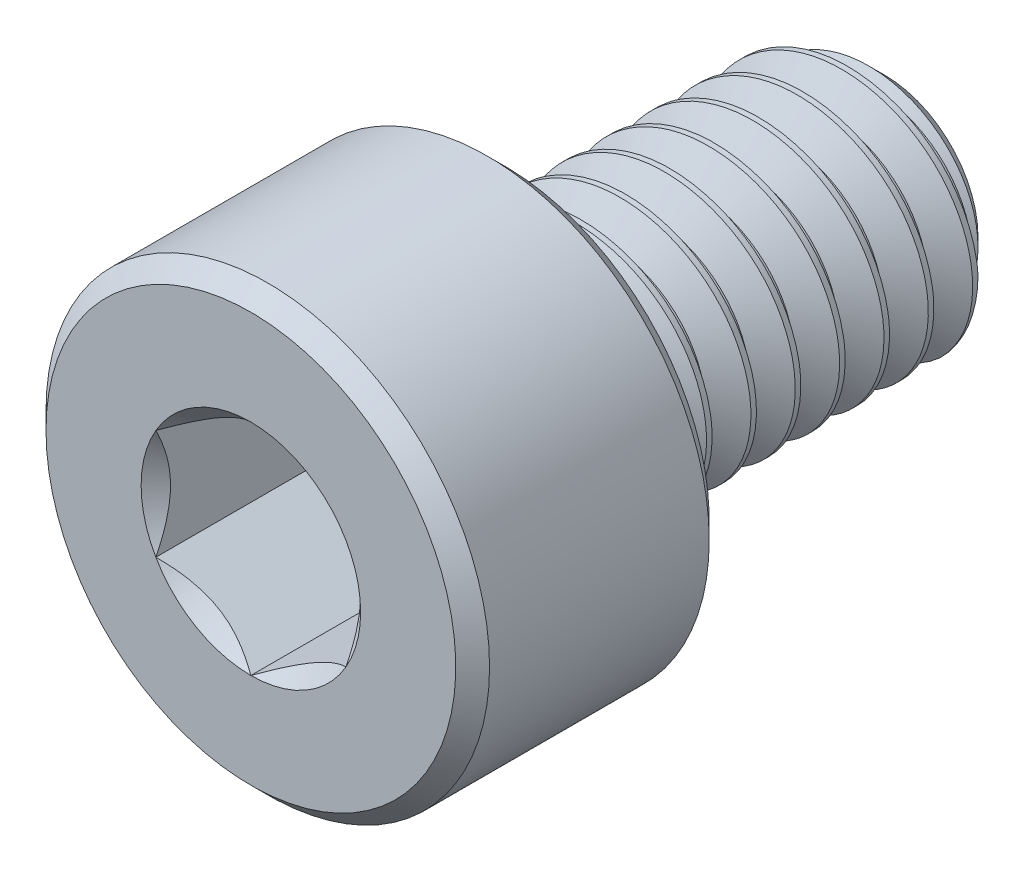
from build123d import *

# Parameters (mm, degrees)
CUT_EXTRUDE1_DEPTH = 3
CUT_SWEEP1_PITCH   = 0.7


# Read off the part's stored shape, not the designer's step: Split1
with BuildPart() as part:
    # Sketch2 → Revolve1 (revolve)
    with BuildSketch(Plane(origin=(0, 0, 0), x_dir=(0, 0, -1), z_dir=(1, 0, 0)), mode=Mode.PRIVATE) as revolve1_sk:
        Polygon((-5, 0), (-5, 3.233333333), (-4.733333333, 3.5), (-1.266666667, 3.5), (-1, 3.233333333), (-1, 2), (4.475, 2), (5, 1.475), (5, 0), align=None)
    revolve(revolve1_sk.sketch.rotate(Axis((0, 0, -5), (0, 0, 1)), 90), axis=Axis((0, 0, -5), (0, 0, 1)))

    # Sketch3 → Cut-Extrude1 (cut)
    with BuildSketch(Plane.XY.offset(5)):
        Polygon((0, 1.732050808), (-1.5, 0.866025404), (-1.5, -0.866025404), (0, -1.732050808), (1.5, -0.866025404), (1.5, 0.866025404), align=None)
    extrude(amount=-CUT_EXTRUDE1_DEPTH, mode=Mode.SUBTRACT)

    # Cut-Extrude2 cone 1 section (through the dimple's axis) → Cut-Extrude2 (revolve, cut)
    with BuildSketch(Plane(origin=(0, 0, 5), x_dir=(0, -1, 0), z_dir=(1, 0, 0))):
        Polygon((0, 0), (1.732050808, 0), (0, 1.732050808), align=None)
    revolve(axis=Axis((0, 0, 5), (0, 0, -1)), mode=Mode.SUBTRACT)


with BuildPart() as body_2:
    # Split1: the piece on the far side of the plane
    add(part.part)
    split(bisect_by=Plane.XY.offset(1), keep=Keep.BOTTOM)

    # Cut-Sweep1: the profile of Sketch6 screwed along a right-hand helix of 9.571429 turns, 6 arcs to a turn; built about Z, then put on its axis
    cut_sweep1_z = Axis((0, 0, 0), (0, 0, 1))
    cut_sweep1_corners = [(2.037888611, 0, 0.021875), (2.037888611, 0, -0.634375), (1.545336663, 0, -0.35), (1.545336663, 0, -0.2625)]
    with BuildLine(mode=Mode.PRIVATE) as cut_sweep1_profile:
        Line(cut_sweep1_corners[0], cut_sweep1_corners[1])
        Line(cut_sweep1_corners[1], cut_sweep1_corners[2])
        Line(cut_sweep1_corners[2], cut_sweep1_corners[3])
        Line(cut_sweep1_corners[3], cut_sweep1_corners[0])
    cut_sweep1_cap = Face(cut_sweep1_profile.wire())
    cut_sweep1_turn_angles = [0, 30, 60, 90, 120, 150, 180, 210, 240, 270, 300, 330, 360]
    cut_sweep1_turn_weights = [1, 0.8660254037844387, 1, 0.8660254037844387, 1, 0.8660254037844387, 1, 0.8660254037844387, 1, 0.8660254037844387, 1, 0.8660254037844387, 1]
    cut_sweep1_turn_rails = [Edge.make_bspline([Vector(p[0], p[1], 0).rotate(cut_sweep1_z, cut_sweep1_turn_angles[k]) / cut_sweep1_turn_weights[k] + Vector(0, 0, p[2] + CUT_SWEEP1_PITCH * cut_sweep1_turn_angles[k] / 360) for k in range(13)], [0, 0, 0, 1, 1, 2, 2, 3, 3, 4, 4, 5, 5, 6, 6, 6], 2, cut_sweep1_turn_weights) for p in cut_sweep1_corners]
    cut_sweep1_turn_sides = [Face.make_surface_from_curves(cut_sweep1_turn_rails[p[0]], cut_sweep1_turn_rails[p[1]]) for p in [(0, 1), (1, 2), (2, 3), (3, 0)]]
    cut_sweep1_turn = Solid(Shell([*cut_sweep1_turn_sides, cut_sweep1_cap, cut_sweep1_cap.rotate(cut_sweep1_z, 360).moved(Location((0, 0, CUT_SWEEP1_PITCH * 360 / 360)))]))
    cut_sweep1_last_angles = [3240, 3270, 3300, 3330, 3360, 3390, 3420, 3432.857142857, 3445.714285714]
    cut_sweep1_last_weights = [1, 0.8660254037844387, 1, 0.8660254037844387, 1, 0.8660254037844387, 1, 0.9749279121818499, 1]
    cut_sweep1_last_rails = [Edge.make_bspline([Vector(p[0], p[1], 0).rotate(cut_sweep1_z, cut_sweep1_last_angles[k]) / cut_sweep1_last_weights[k] + Vector(0, 0, p[2] + CUT_SWEEP1_PITCH * cut_sweep1_last_angles[k] / 360) for k in range(9)], [0, 0, 0, 1, 1, 2, 2, 3, 3, 4, 4, 4], 2, cut_sweep1_last_weights) for p in cut_sweep1_corners]
    cut_sweep1_last_sides = [Face.make_surface_from_curves(cut_sweep1_last_rails[p[0]], cut_sweep1_last_rails[p[1]]) for p in [(0, 1), (1, 2), (2, 3), (3, 0)]]
    cut_sweep1_last = Solid(Shell([*cut_sweep1_last_sides, cut_sweep1_cap.rotate(cut_sweep1_z, 3240).moved(Location((0, 0, CUT_SWEEP1_PITCH * 3240 / 360))), cut_sweep1_cap.rotate(cut_sweep1_z, 3445.714285714).moved(Location((0, 0, CUT_SWEEP1_PITCH * 3445.714285714 / 360)))]))
    cut_sweep1_each = [*[cut_sweep1_turn.moved(Location((0, 0, CUT_SWEEP1_PITCH * i))) for i in range(9)], cut_sweep1_last]
    add(Plane(origin=(0, 0, -5), x_dir=(0, 1, 0), z_dir=(0, 0, 1)) * Compound([cut_sweep1_each[i] for i in range(0, 10, 2)]), mode=Mode.SUBTRACT)
    add(Plane(origin=(0, 0, -5), x_dir=(0, 1, 0), z_dir=(0, 0, 1)) * Compound([cut_sweep1_each[i] for i in range(1, 10, 2)]), mode=Mode.SUBTRACT)


with BuildPart() as part_1:
    add(part.part)

    # Split1
    split(bisect_by=Plane.XY.offset(1), keep=Keep.TOP)

    add(body_2.part)  # Boss-Extrude2 merges body 2
    # Boss-Extrude2 cone 1 section (through the dimple's axis) → Boss-Extrude2 (revolve)
    with BuildSketch(Plane(origin=(0, 0, 1), x_dir=(0, -1, 0), z_dir=(1, 0, 0))):
        Polygon((0, 0), (2, 0), (0, 5.494954839), align=None)
    revolve(axis=Axis((0, 0, 1), (0, 0, -1)))


solid = part_1.part
